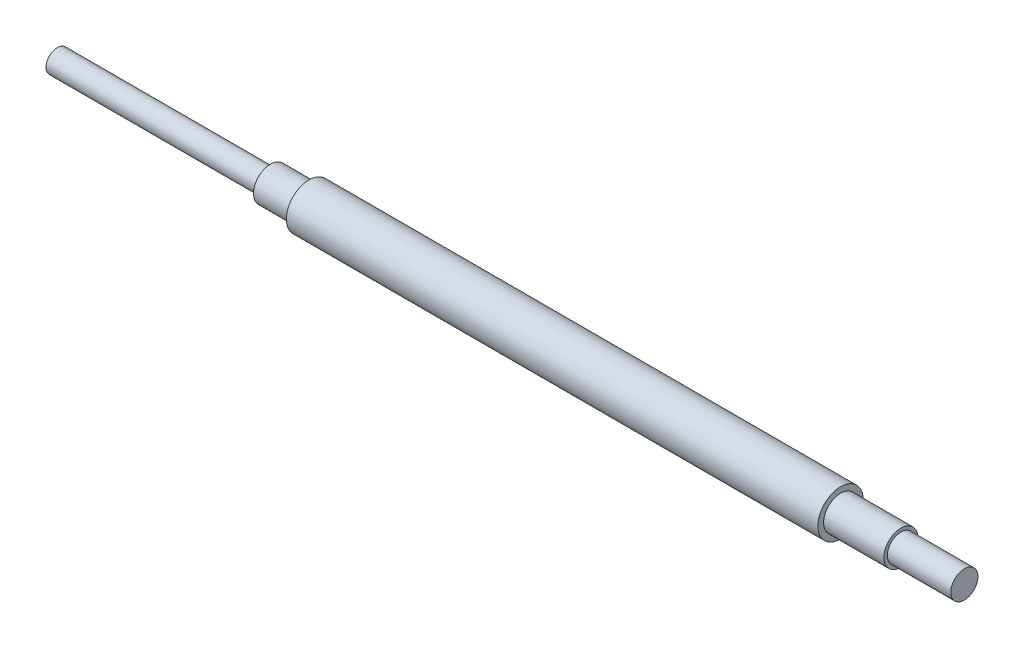
from build123d import *


with BuildPart() as part:
    # Sketch1 → Revolve1 (revolve)
    with BuildSketch(Plane.XY):
        Polygon((-7.896553455, 3.81), (-7.896553455, 0), (-261.896553455, 0), (-261.896553455, 3.175), (-202.206553455, 3.175), (-202.206553455, 4.7625), (-191.411553455, 4.7625), (-191.411553455, 6.35), (-42.567553455, 6.35), (-42.567553455, 4.7625), (-25.676553455, 4.7625), (-25.676553455, 3.81), align=None)
    revolve(axis=Axis((-261.896553455, 0, 0), (1, 0, 0)))


solid = part.part
